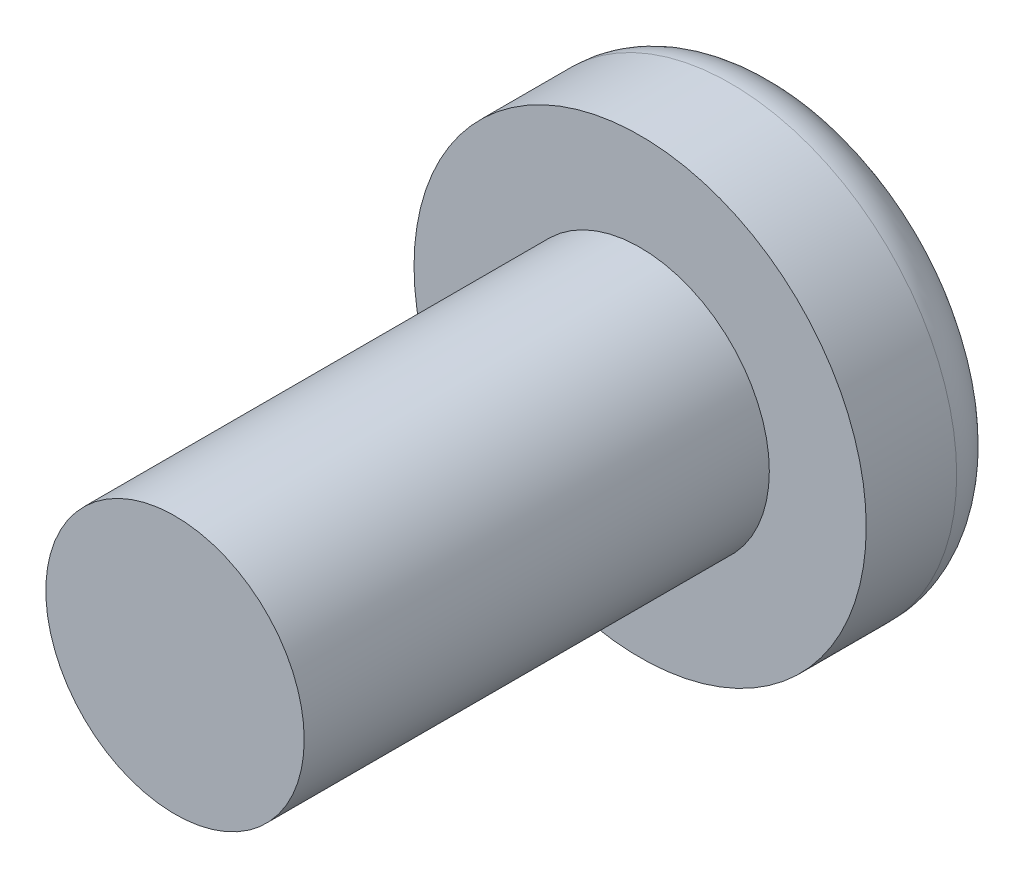
from build123d import *

# Parameters (mm, degrees)
SKETCH_1_R          = 5
EXTRUDE_1_DEPTH     = 18
SKETCH_2_R          = 8.75
EXTRUDE_2_DEPTH     = 5.5
FILLET_1_R          = 2
CUT_EXTRUDE_1_DEPTH = 2


with BuildPart() as part:
    # 草图1 → 凸台-拉伸1 (new body)
    with BuildSketch(Plane.XY):
        Circle(SKETCH_1_R)
    extrude(amount=EXTRUDE_1_DEPTH)

    # 草图2 → 凸台-拉伸2 (add)
    with BuildSketch(Plane(origin=(0, 0, 0), x_dir=(-1, 0, 0), z_dir=(0, 0, -1))):
        Circle(SKETCH_2_R)
    extrude(amount=EXTRUDE_2_DEPTH)

    # 圆角1
    fillet_1_edges = [part.edges().sort_by_distance(p)[0] for p in [
        (8.75, 0, -5.5),
    ]]
    fillet(fillet_1_edges, radius=FILLET_1_R)

    # 草图3 → 切除-拉伸1 (cut)
    with BuildSketch(Plane(origin=(0, 0, -5.5), x_dir=(-1, 0, 0), z_dir=(0, 0, -1))):
        Polygon((-0.707106781, 0.707106781), (-0.707106781, 6.006401657), (0.707106781, 6.006401657), (0.707106781, 0.707106781), (6.006401657, 0.707106781), (6.006401657, -0.707106781), (0.707106781, -0.707106781), (0.707106781, -6.006401657), (-0.707106781, -6.006401657), (-0.707106781, -0.707106781), (-6.006401657, -0.707106781), (-6.006401657, 0.707106781), align=None)
    extrude(amount=-CUT_EXTRUDE_1_DEPTH, mode=Mode.SUBTRACT)


solid = part.part
